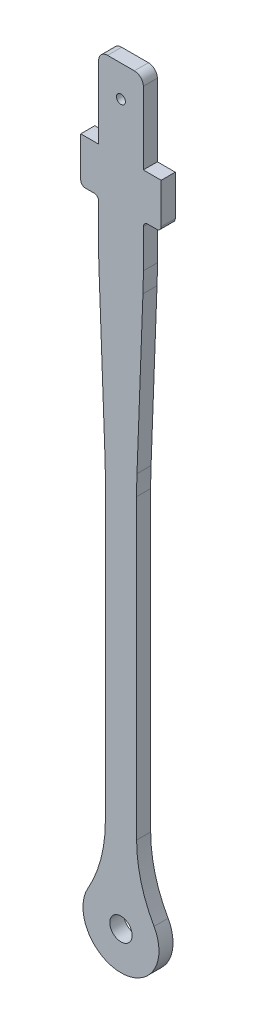
from build123d import *

# Parameters (mm, degrees)
SKETCH2_R           = 1.27
SKETCH2_R_2         = 3.175
BOSS_EXTRUDE1_DEPTH = 4


with BuildPart() as part:
    # Sketch2 → Boss-Extrude1 (new body)
    with BuildSketch(Plane.XY):
        with BuildLine():
            Line((4.552043366, 53.654489758), (6.242956634, 98.745510242))
            ThreePointArc((6.242956634, 98.745510242), (6.323236809, 101.600501634), (6.35, 104.456496116))
            Line((6.35, 104.456496116), (6.35, 115.316))
            ThreePointArc((6.35, 115.316), (6.721974388, 116.214025612), (7.62, 116.586))
            Line((7.62, 116.586), (10.16, 116.586))
            ThreePointArc((10.16, 116.586), (11.058025612, 116.957974388), (11.43, 117.856))
            Line((11.43, 117.856), (11.43, 129.286))
            Line((11.43, 129.286), (6.35, 129.286))
            Line((6.35, 129.286), (6.35, 149.86))
            ThreePointArc((6.35, 149.86), (5.606051224, 151.656051224), (3.81, 152.4))
            Line((3.81, 152.4), (-3.81, 152.4))
            ThreePointArc((-3.81, 152.4), (-5.606051224, 151.656051224), (-6.35, 149.86))
            Line((-6.35, 149.86), (-6.35, 129.286))
            Line((-6.35, 129.286), (-11.43, 129.286))
            Line((-11.43, 129.286), (-11.43, 117.856))
            ThreePointArc((-11.43, 117.856), (-11.058025612, 116.957974388), (-10.16, 116.586))
            Line((-10.16, 116.586), (-7.62, 116.586))
            ThreePointArc((-7.62, 116.586), (-6.721974388, 116.214025612), (-6.35, 115.316))
            Line((-6.35, 115.316), (-6.35, 104.456496116))
            ThreePointArc((-6.35, 104.456496116), (-6.323236809, 101.600501634), (-6.242956634, 98.745510242))
            Line((-6.242956634, 98.745510242), (-4.552043366, 53.654489758))
            ThreePointArc((-4.552043366, 53.654489758), (-4.471763191, 50.799498366), (-4.445, 47.943503884))
            Line((-4.445, 47.943503884), (-4.445, -36.540821929))
            ThreePointArc((-4.445, -36.540821929), (-5.702774085, -46.249600926), (-9.393051948, -55.317358893))
            ThreePointArc((-9.393051948, -55.317358893), (0, -71.432377699), (9.393051948, -55.317358893))
            ThreePointArc((9.393051948, -55.317358893), (5.702774085, -46.249600926), (4.445, -36.540821929))
            Line((4.445, -36.540821929), (4.445, 47.943503884))
            ThreePointArc((4.445, 47.943503884), (4.471763191, 50.799498366), (4.552043366, 53.654489758))
        make_face()
        with Locations((0, 143.51)):
            Circle(SKETCH2_R, mode=Mode.SUBTRACT)
        with Locations((0, -60.637377699)):
            Circle(SKETCH2_R_2, mode=Mode.SUBTRACT)
    extrude(amount=BOSS_EXTRUDE1_DEPTH)


solid = part.part
